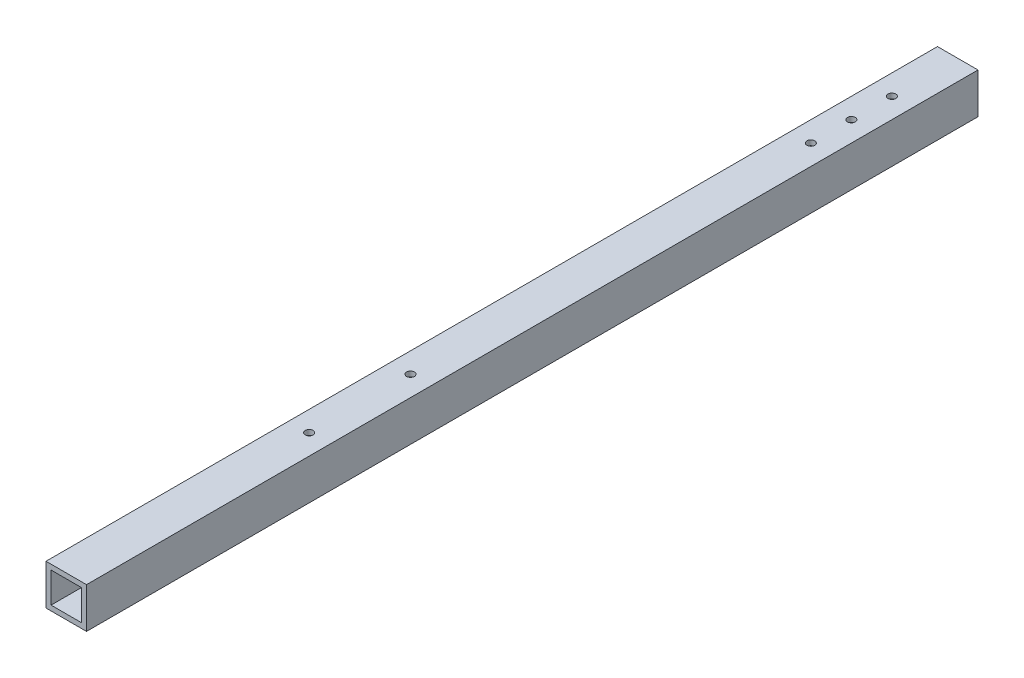
from build123d import *

# Parameters (mm, degrees)
SKETCH1_W                        = 25.4
SKETCH1_H                        = 25.4
SKETCH1_W_2                      = 19.05
SKETCH1_H_2                      = 19.05
BOSS_EXTRUDE1_DEPTH              = 279.4
F_10_0_1935_DIAMETER_HOLE1_D     = 4.9149
F_10_0_1935_DIAMETER_HOLE1_DEPTH = 50.8
F_10_0_1935_DIAMETER_HOLE1_TIP   = 1.476584928
SKETCH5_R                        = 2.464210786
CUT_EXTRUDE1_DEPTH               = 281.839473721


with BuildPart() as part:
    # Sketch1 → Boss-Extrude1 (new, symmetric)
    with BuildSketch(Plane.XY):
        Rectangle(SKETCH1_W, SKETCH1_H)
        Rectangle(SKETCH1_W_2, SKETCH1_H_2, mode=Mode.SUBTRACT)
    extrude(amount=BOSS_EXTRUDE1_DEPTH, both=True)

    # #10 (0.1935) Diameter Hole1
    with Locations(Plane(origin=(0, 12.7, 0), x_dir=(1, 0, 0), z_dir=(0, 1, 0))):
        with Locations((0, -63.627), (0, 187.325), (0, 212.725), (0, 238.125)):
            Hole(F_10_0_1935_DIAMETER_HOLE1_D / 2, depth=F_10_0_1935_DIAMETER_HOLE1_DEPTH)
            with Locations((0, 0, -(F_10_0_1935_DIAMETER_HOLE1_DEPTH + F_10_0_1935_DIAMETER_HOLE1_TIP / 2))):  # 118° drill point
                Cone(0, F_10_0_1935_DIAMETER_HOLE1_D / 2, F_10_0_1935_DIAMETER_HOLE1_TIP, mode=Mode.SUBTRACT)

    # Sketch5 → Cut-Extrude1 (cut, through all)
    with BuildSketch(Plane(origin=(0, 12.7, 0), x_dir=(1, 0, 0), z_dir=(0, 1, 0))):
        with Locations((0, -127.127)):
            Circle(SKETCH5_R)
    extrude(amount=-CUT_EXTRUDE1_DEPTH, mode=Mode.SUBTRACT)


solid = part.part
